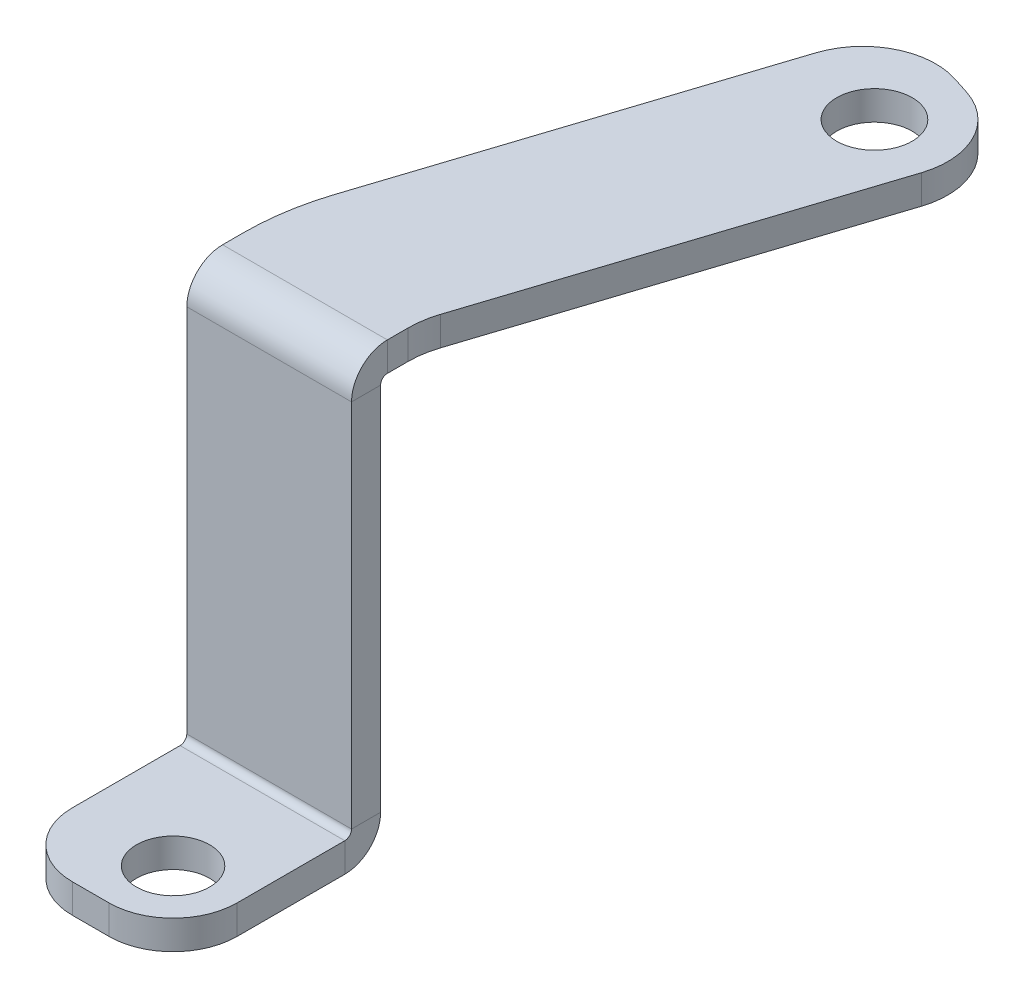
from build123d import *

# Parameters (mm, degrees)
SKETCH1_R                    = 4
BASE_FLANGE1_DEPTH           = 3.175
EDGE_FLANGE1_STRIP_W         = 14.1732
EDGE_FLANGE1_STRIP_H         = 3.175
EDGE_FLANGE1_STRIP_CUT_DEPTH = 18
EDGE_FLANGE1_DEPTH           = 18
EDGE_FLANGE2_STRIP_W         = 14.1732
EDGE_FLANGE2_STRIP_H         = 3.175
EDGE_FLANGE2_STRIP_CUT_DEPTH = 18
EDGE_FLANGE2_DEPTH           = 18
SKETCH12_R                   = 4.125
BOSS_EXTRUDE1_DEPTH          = 3.175


# Sheet-metal steps are written as plain solids
with BuildPart() as part:
    # Sketch1 → Base-Flange1 (new body)
    with BuildSketch(Plane(origin=(0, 0, 0), x_dir=(1, 0, 0), z_dir=(0, 1, 0))):
        with BuildLine():
            Line((7, 0), (7, 12.5))
            Line((7, 12.5), (-11, 12.5))
            Line((-11, 12.5), (-11, 0))
            ThreePointArc((-11, 0), (-8.949747468, -4.949747468), (-4, -7))
            Line((-4, -7), (0, -7))
            ThreePointArc((0, -7), (4.949747468, -4.949747468), (7, 0))
        make_face()
        with Locations(Location((0, 0, 0), (0, 0, 270))):
            Circle(SKETCH1_R, mode=Mode.SUBTRACT)
    extrude(amount=-BASE_FLANGE1_DEPTH)

    # Edge-Flange1 strip (across the edge) → Edge-Flange1 strip cut (cut)
    with BuildSketch(Plane(origin=(7, 0, -12.5), x_dir=(0, 0, 1), z_dir=(-1, 0, 0))):
        with Locations((-6.35, -1.5875)):
            Rectangle(EDGE_FLANGE1_STRIP_W, EDGE_FLANGE1_STRIP_H)
    extrude(amount=EDGE_FLANGE1_STRIP_CUT_DEPTH, mode=Mode.SUBTRACT)

    # Edge-Flange1 section (across the edge) → Edge-Flange1 (add)
    with BuildSketch(Plane(origin=(7, 0, -12.5), x_dir=(0, 0, 1), z_dir=(-1, 0, 0))):
        with BuildLine():
            Line((-3.175, 0.7366), (-3.175, 41.8875))
            Line((-3.175, 41.8875), (0, 41.8875))
            Line((0, 41.8875), (0, 0.7366))
            ThreePointArc((0, 0.7366), (0.215745145, 0.215745145), (0.7366, 0))
            Line((0.7366, 0), (0.7366, -3.175))
            ThreePointArc((0.7366, -3.175), (-2.029318885, -2.029318885), (-3.175, 0.7366))
        make_face()
    extrude(amount=EDGE_FLANGE1_DEPTH)

    # Edge-Flange2 strip (across the edge) → Edge-Flange2 strip cut (cut)
    with BuildSketch(Plane(origin=(-11, 41.8875, -15.675), x_dir=(0, -1, 0), z_dir=(1, 0, 0))):
        with Locations((-6.35, -1.5875)):
            Rectangle(EDGE_FLANGE2_STRIP_W, EDGE_FLANGE2_STRIP_H)
    extrude(amount=EDGE_FLANGE2_STRIP_CUT_DEPTH, mode=Mode.SUBTRACT)

    # Edge-Flange2 section (across the edge) → Edge-Flange2 (add)
    with BuildSketch(Plane(origin=(-11, 41.8875, -15.675), x_dir=(0, -1, 0), z_dir=(1, 0, 0))):
        with BuildLine():
            Line((-3.175, 0.7366), (-3.175, 3))
            Line((-3.175, 3), (0, 3))
            Line((0, 3), (0, 0.7366))
            ThreePointArc((0, 0.7366), (0.215745145, 0.215745145), (0.7366, 0))
            Line((0.7366, 0), (0.7366, -3.175))
            ThreePointArc((0.7366, -3.175), (-2.029318885, -2.029318885), (-3.175, 0.7366))
        make_face()
    extrude(amount=EDGE_FLANGE2_DEPTH)

    # Sketch12 → Boss-Extrude1 (add)
    with BuildSketch(Plane(origin=(0, 45.0625, 0), x_dir=(1, 0, 0), z_dir=(0, 1, 0))):
        with BuildLine():
            Line((7, 18.675), (-11, 18.675))
            ThreePointArc((-11, 18.675), (-10.657865377, 23.027974643), (-9.639863923, 27.27404546))
            Line((-9.639863923, 27.27404546), (3.238154817, 66.964241218))
            ThreePointArc((3.238154817, 66.964241218), (7.212761051, 71.621798227), (13.316622217, 72.104717351))
            Line((13.316622217, 72.104717351), (15.218990158, 71.487468443))
            ThreePointArc((15.218990158, 71.487468443), (19.876547167, 67.512862208), (20.359466291, 61.409001043))
            Line((20.359466291, 61.409001043), (7.481447551, 21.718805285))
            ThreePointArc((7.481447551, 21.718805285), (7.121105439, 20.215823024), (7, 18.675))
        make_face()
        with Locations(Location((12.749994525, 63.877996676, 0), (0, 0, 270))):
            Circle(SKETCH12_R, mode=Mode.SUBTRACT)
    extrude(amount=-BOSS_EXTRUDE1_DEPTH)


solid = part.part
